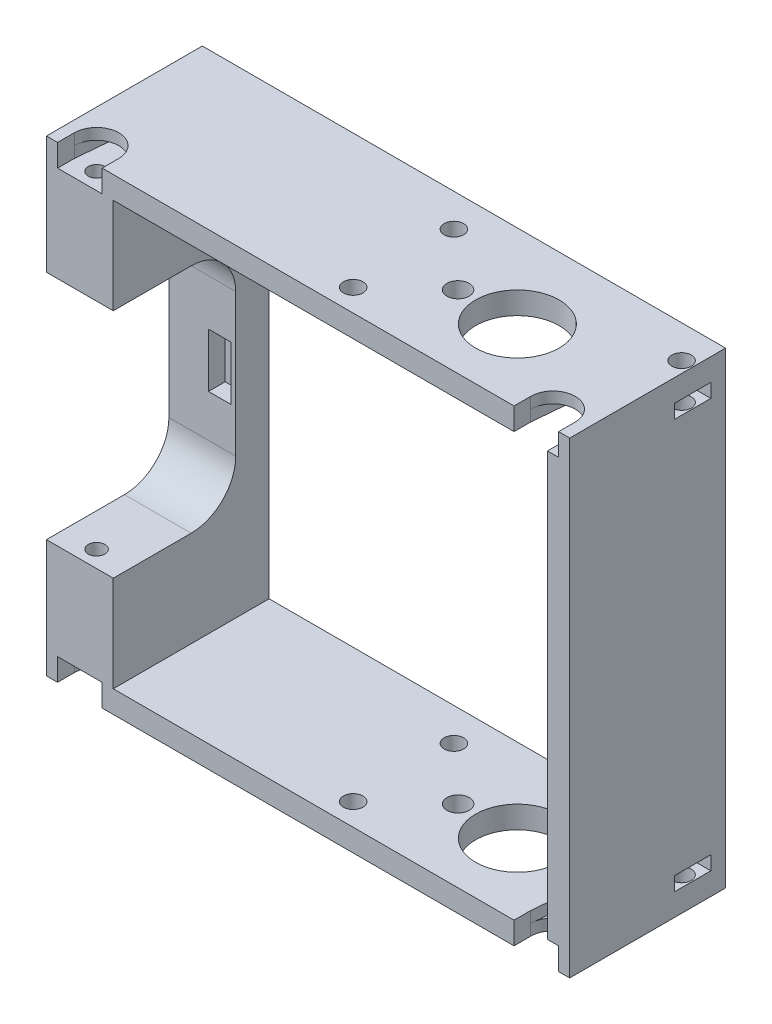
from build123d import *

# Parameters (mm, degrees)
SALIENTE_EXTRUIR1_DEPTH      = 4
SALIENTE_EXTRUIR1_DEPTH_BACK = 24
CROQUIS1_W                   = 94
CROQUIS1_H                   = 84
CROQUIS1_W_2                 = 78
CROQUIS1_H_2                 = 76
CROQUIS10_R                  = 1.5
CORTAR_EXTRUIR6_DEPTH        = 109.830188826
CORTAR_EXTRUIR1_DEPTH        = 2
CORTAR_EXTRUIR5_DEPTH        = 2
CORTAR_EXTRUIR2_REACH        = 122.073
CROQUIS12_R                  = 7.5
CROQUIS12_R_2                = 1.75
CROQUIS12_R_3                = 2
CORTAR_EXTRUIR7_DEPTH        = 10
CROQUIS17_W                  = 4
CROQUIS17_H                  = 9.7
CORTAR_EXTRUIR10_DEPTH       = 3
CORTAR_EXTRUIR11_DEPTH       = 2.5
SIMETR_A2_COPY_1_DEPTH       = 2
SIMETR_A2_COPY_2_DEPTH       = 2


with BuildPart() as part:
    # Croquis1 → Saliente-Extruir1 (new, two sides: drawn at the far end of the back side and taken through both)
    with BuildSketch(Plane.XY.offset(-SALIENTE_EXTRUIR1_DEPTH_BACK)):
        with Locations((-17.9, 28.75)):
            Rectangle(CROQUIS1_W, CROQUIS1_H)
        with Locations((-13.9, 28.75)):
            Rectangle(CROQUIS1_W_2, CROQUIS1_H_2, mode=Mode.SUBTRACT)
    extrude(amount=SALIENTE_EXTRUIR1_DEPTH + SALIENTE_EXTRUIR1_DEPTH_BACK)

    # Croquis10 → Cortar-Extruir6 (cut, through all)
    with BuildSketch(Plane(origin=(0, 70.75, 0), x_dir=(1, 0, 0), z_dir=(0, 1, 0))):
        with Locations((-58.9, -1)):
            Circle(CROQUIS10_R)
    extrude(amount=-CORTAR_EXTRUIR6_DEPTH, mode=Mode.SUBTRACT)

    # Croquis2 → Cortar-Extruir1 (cut)
    with BuildSketch(Plane(origin=(0, -13.25, 0), x_dir=(-1, 0, 0), z_dir=(0, -1, 0))):
        with BuildLine():
            Line((54.9, -1), (54.9, -4))
            Line((54.9, -4), (62.9, -4))
            Line((62.9, -4), (62.9, -1))
            ThreePointArc((62.9, -1), (58.9, 3), (54.9, -1))
        make_face()
    cortar_extruir1 = extrude(amount=-CORTAR_EXTRUIR1_DEPTH, mode=Mode.SUBTRACT)

    # Croquis9 → Cortar-Extruir5 (cut)
    with BuildSketch(Plane(origin=(0, -9.25, 0), x_dir=(1, 0, 0), z_dir=(0, 1, 0))):
        with BuildLine():
            Line((-61.389870926, 15.724817194), (-62.9, -1))
            Line((-62.9, -1), (-62.9, -4))
            Line((-62.9, -4), (-54.9, -4))
            Line((-54.9, -4), (-54.9, -1))
            Line((-54.9, -1), (-56.410129074, 15.724817194))
            ThreePointArc((-56.410129074, 15.724817194), (-58.9, 18), (-61.389870926, 15.724817194))
        make_face()
    cortar_extruir5 = extrude(amount=-CORTAR_EXTRUIR5_DEPTH, mode=Mode.SUBTRACT)

    # Croquis5 → Cortar-Extruir2 (cut, up to next)
    with BuildSketch(Plane.ZY.offset(64.9), mode=Mode.PRIVATE) as cortar_extruir2_sk1:
        with BuildLine():
            Line((-18, 41.55), (-18, 15.95))
            ThreePointArc((-18, 15.95), (-15.656854249, 10.293145751), (-10, 7.95))
            Line((-10, 7.95), (4, 7.95))
            Line((4, 7.95), (4, 49.55))
            Line((4, 49.55), (-10, 49.55))
            ThreePointArc((-10, 49.55), (-15.656854249, 47.206854249), (-18, 41.55))
        make_face()
    cortar_extruir2_tool1 = extrude(cortar_extruir2_sk1.sketch, amount=-CORTAR_EXTRUIR2_REACH, mode=Mode.PRIVATE) & part.part
    add(cortar_extruir2_tool1.solids().sort_by_distance((-64.9, 28.75, -6.714921))[0], mode=Mode.SUBTRACT)

    # Croquis12 → Cortar-Extruir7 (cut)
    with BuildSketch(Plane.XZ.offset(13.25)):
        with Locations((6.65, -9.05)):
            Circle(CROQUIS12_R)
        with Locations((-13.8, 0)):
            Circle(CROQUIS12_R_2)
        with Locations((-13.8, -18.1)):
            Circle(CROQUIS12_R_2)
        with Locations((-4, -9.05)):
            Circle(CROQUIS12_R_3)
        with Locations((27.1, -18.1)):
            Circle(CROQUIS12_R_2)
    cortar_extruir7 = extrude(amount=-CORTAR_EXTRUIR7_DEPTH, mode=Mode.SUBTRACT)

    # Croquis17 → Cortar-Extruir10 (cut)
    with BuildSketch(Plane.XY.offset(-18)):
        with Locations((-55.789108289, 28.409050584)):
            Rectangle(CROQUIS17_W, CROQUIS17_H)
    extrude(amount=-CORTAR_EXTRUIR10_DEPTH, mode=Mode.SUBTRACT)

    # Croquis20 → Cortar-Extruir11 (cut)
    with BuildSketch(Plane(origin=(0, -9.25, 0), x_dir=(-1, 0, 0), z_dir=(0, -1, 0))):
        Polygon((-29.1, 14.85), (-27.1, 14.85), (-25.223611625, 14.85), (-24.285417438, 16.475), (-23.34722325, 18.1), (-24.285417438, 19.725), (-25.223611625, 21.35), (-27.1, 21.35), (-29.1, 21.35), align=None)
    cortar_extruir11 = extrude(amount=-CORTAR_EXTRUIR11_DEPTH, mode=Mode.SUBTRACT)

    # Simetría3: Cortar-Extruir1, Cortar-Extruir5 across plane
    add(cortar_extruir1.mirror(Plane.ZY.offset(17.9)), mode=Mode.SUBTRACT)
    add(cortar_extruir5.mirror(Plane.ZY.offset(17.9)), mode=Mode.SUBTRACT)

    # Simetría2: Cortar-Extruir1, Cortar-Extruir5, Cortar-Extruir7, Cortar-Extruir11 across plane
    add(cortar_extruir1.mirror(Plane(origin=(0, 28.75, 0), x_dir=(0, 0, 1), z_dir=(0, -1, 0))), mode=Mode.SUBTRACT)
    add(cortar_extruir5.mirror(Plane(origin=(0, 28.75, 0), x_dir=(0, 0, 1), z_dir=(0, -1, 0))), mode=Mode.SUBTRACT)
    add(cortar_extruir7.mirror(Plane(origin=(0, 28.75, 0), x_dir=(0, 0, 1), z_dir=(0, -1, 0))), mode=Mode.SUBTRACT)
    add(cortar_extruir11.mirror(Plane(origin=(0, 28.75, 0), x_dir=(0, 0, 1), z_dir=(0, -1, 0))), mode=Mode.SUBTRACT)

    # Simetría2 copy 1 sketch → Simetría2 copy 1 (cut)
    with BuildSketch(Plane(origin=(-35.8, 70.75, 0), x_dir=(1, 0, 0), z_dir=(0, 1, 0))):
        with BuildLine():
            Line((54.9, -1), (54.9, -4))
            Line((54.9, -4), (62.9, -4))
            Line((62.9, -4), (62.9, -1))
            ThreePointArc((62.9, -1), (58.9, 3), (54.9, -1))
        make_face()
    extrude(amount=-SIMETR_A2_COPY_1_DEPTH, mode=Mode.SUBTRACT)

    # Simetría2 copy 2 sketch → Simetría2 copy 2 (cut)
    with BuildSketch(Plane(origin=(-35.8, 66.75, 0), x_dir=(-1, 0, 0), z_dir=(0, -1, 0))):
        with BuildLine():
            Line((-61.389870926, 15.724817194), (-62.9, -1))
            Line((-62.9, -1), (-62.9, -4))
            Line((-62.9, -4), (-54.9, -4))
            Line((-54.9, -4), (-54.9, -1))
            Line((-54.9, -1), (-56.410129074, 15.724817194))
            ThreePointArc((-56.410129074, 15.724817194), (-58.9, 18), (-61.389870926, 15.724817194))
        make_face()
    extrude(amount=-SIMETR_A2_COPY_2_DEPTH, mode=Mode.SUBTRACT)


solid = part.part
